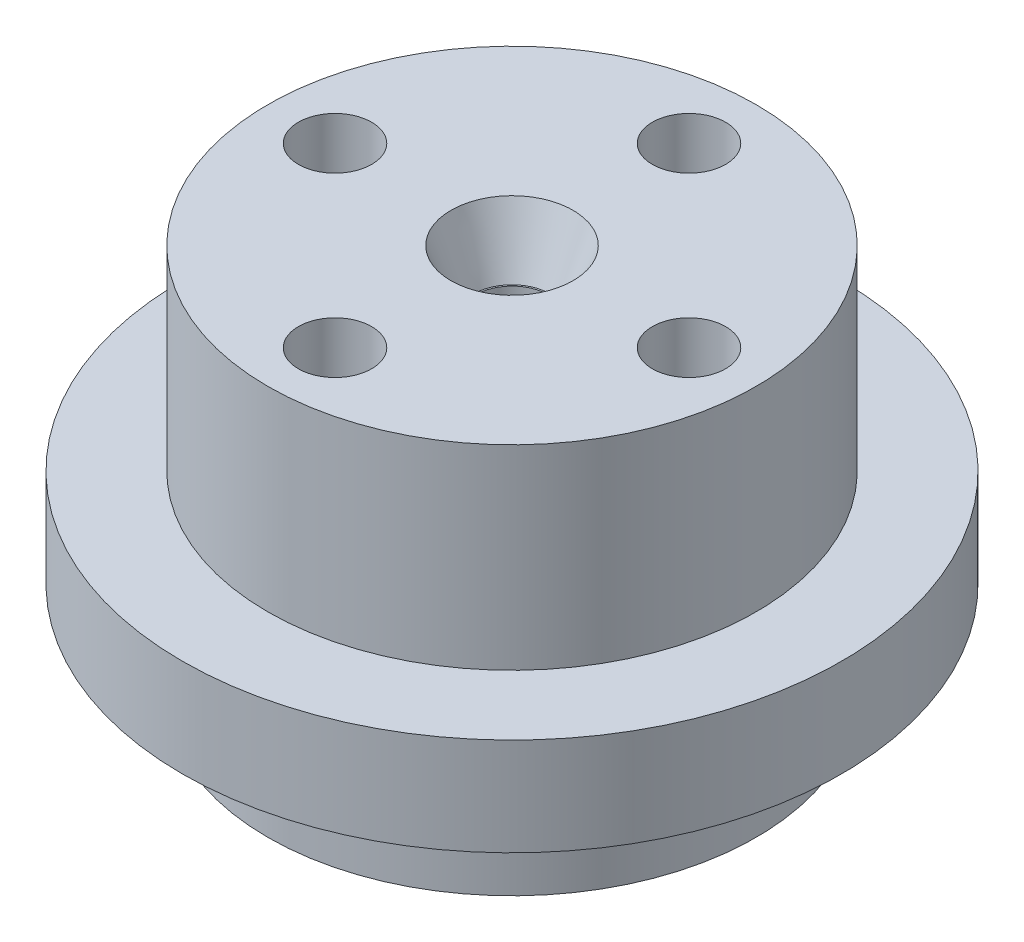
from build123d import *

# Parameters (mm, degrees)
SKETCH1_R                = 10
BOSS_EXTRUDE1_DEPTH      = 16
SKETCH2_R                = 1.5
CUT_EXTRUDE1_DEPTH       = 22.354156504
SKETCH3_R                = 2.5
CUT_EXTRUDE2_DEPTH       = 2.5
CUT_EXTRUDE2_DRAFT       = -20.5
BOSS_EXTRUDE2_DEPTH      = 2
BOSS_EXTRUDE2_DEPTH_BACK = 2
SKETCH5_R                = 13.5
SKETCH7_R                = 1.5
CUT_EXTRUDE3_DEPTH       = 10
SKETCH8_R                = 1
CUT_EXTRUDE4_DEPTH       = 22.552262062
SKETCH9_R                = 1.5
CUT_EXTRUDE5_DEPTH       = 25.909837414


with BuildPart() as part:
    # Sketch1 → Boss-Extrude1 (new body)
    with BuildSketch(Plane(origin=(0, 0, 0), x_dir=(1, 0, 0), z_dir=(0, 1, 0))):
        Circle(SKETCH1_R)
    extrude(amount=BOSS_EXTRUDE1_DEPTH)

    # Sketch2 → Cut-Extrude1 (cut, through all)
    with BuildSketch(Plane(origin=(0, 16, 0), x_dir=(1, 0, 0), z_dir=(0, 1, 0))):
        Circle(SKETCH2_R)
    extrude(amount=-CUT_EXTRUDE1_DEPTH, mode=Mode.SUBTRACT)


with BuildPart() as cut_extrude2_tool:
    # Sketch3 → Cut-Extrude2 (with draft: the straight prism first)
    with BuildSketch(Plane(origin=(0, 16, 0), x_dir=(1, 0, 0), z_dir=(0, 1, 0))):
        Circle(SKETCH3_R)
    extrude(amount=-CUT_EXTRUDE2_DEPTH)
    # Cut-Extrude2: the draft: its side faces are tilted about the plane it starts from
    cut_extrude2_sides = [cut_extrude2_tool.faces().sort_by_distance(p)[0] for p in [
        (-2.5, 14.75, 0),
    ]]
    draft(cut_extrude2_sides, Plane(origin=(0, 16, 0), x_dir=(1, 0, 0), z_dir=(0, 1, 0)), CUT_EXTRUDE2_DRAFT)


with BuildPart() as part_1:
    add(part.part)

    # Cut-Extrude2: cut by cut_extrude2_tool
    add(cut_extrude2_tool.part, mode=Mode.SUBTRACT)

    # Sketch5 → Boss-Extrude2 (add, two sides: drawn at the far end of the back side and taken through both)
    with BuildSketch(Plane(origin=(0, 6, 0), x_dir=(-1, 0, 0), z_dir=(0, -1, 0)).offset(-BOSS_EXTRUDE2_DEPTH_BACK)):
        Circle(SKETCH5_R)
    extrude(amount=BOSS_EXTRUDE2_DEPTH + BOSS_EXTRUDE2_DEPTH_BACK)

    # Sketch7 → Cut-Extrude3 (cut)
    with BuildSketch(Plane(origin=(0, 16, 0), x_dir=(1, 0, 0), z_dir=(0, 1, 0))):
        with Locations((0, 7.25)):
            Circle(SKETCH7_R)
        with Locations((7.25, 0)):
            Circle(SKETCH7_R)
        with Locations((0, -7.25)):
            Circle(SKETCH7_R)
        with Locations((-7.25, 0)):
            Circle(SKETCH7_R)
    extrude(amount=-CUT_EXTRUDE3_DEPTH, mode=Mode.SUBTRACT)

    # Sketch8 → Cut-Extrude4 (cut, through all)
    with BuildSketch(Plane(origin=(0, 6, 0), x_dir=(1, 0, 0), z_dir=(0, 1, 0))):
        with Locations((-7.25, 0)):
            Circle(SKETCH8_R)
        with Locations((0, 7.25)):
            Circle(SKETCH8_R)
        with Locations((7.25, 0)):
            Circle(SKETCH8_R)
        with Locations((0, -7.25)):
            Circle(SKETCH8_R)
    extrude(amount=-CUT_EXTRUDE4_DEPTH, mode=Mode.SUBTRACT)

    # Sketch9 → Cut-Extrude5 (cut, through all)
    with BuildSketch(Plane(origin=(0, 16, 0), x_dir=(1, 0, 0), z_dir=(0, 1, 0))):
        Circle(SKETCH9_R)
    extrude(amount=-CUT_EXTRUDE5_DEPTH, mode=Mode.SUBTRACT)


solid = part_1.part
